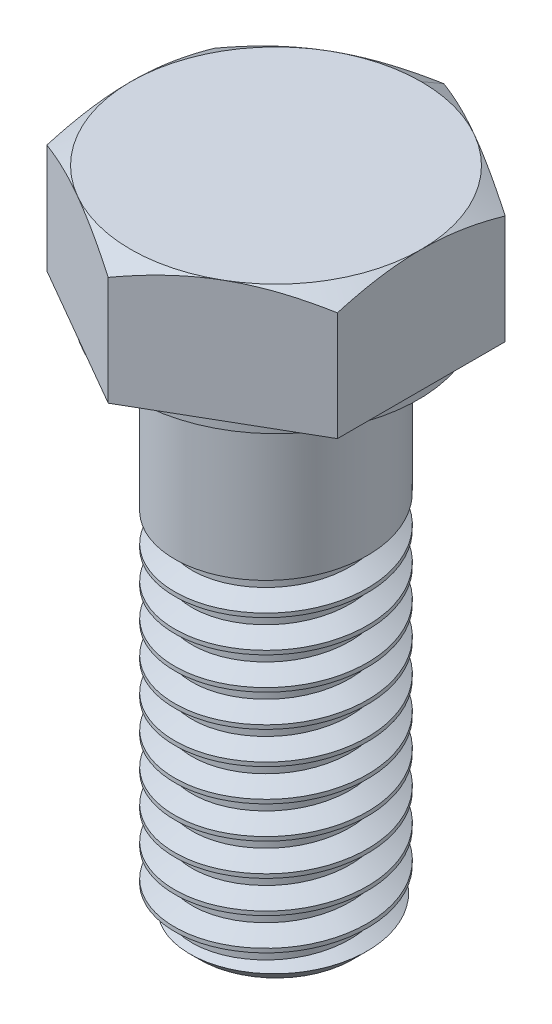
from build123d import *

# Parameters (mm, degrees)
BOSS_EXTRUDE1_DEPTH = 6
SKETCH2_R           = 7
BOSS_EXTRUDE2_DEPTH = 0.48
SKETCH3_R           = 4.745
BOSS_EXTRUDE3_DEPTH = 25.5
CHAMFER1_SIZE       = 1
CUT_SWEEP2_PITCH    = 1.5875
CUT_EXTRUDE1_DEPTH  = 10


with BuildPart() as part:
    # Sketch1 → Boss-Extrude1 (new body)
    with BuildSketch(Plane(origin=(0, 0, 0), x_dir=(1, 0, 0), z_dir=(0, 1, 0))):
        Polygon((0, 8.256108849), (-7.15, 4.128054425), (-7.15, -4.128054425), (0, -8.256108849), (7.15, -4.128054425), (7.15, 4.128054425), align=None)
    extrude(amount=-BOSS_EXTRUDE1_DEPTH)

    # Sketch2 → Boss-Extrude2 (add)
    with BuildSketch(Plane.XZ.offset(6)):
        with Locations(Location((0, 0, 0), (0, 0, 90))):
            Circle(SKETCH2_R)
    extrude(amount=BOSS_EXTRUDE2_DEPTH)

    # Sketch3 → Boss-Extrude3 (add)
    with BuildSketch(Plane.XZ.offset(6.48)):
        with Locations(Location((0, 0, 0), (0, 0, 270))):
            Circle(SKETCH3_R)
    extrude(amount=BOSS_EXTRUDE3_DEPTH)

    # Chamfer1
    chamfer1_edges = [part.edges().sort_by_distance(p)[0] for p in [
        (0, -31.98, 4.745),
    ]]
    chamfer(chamfer1_edges, length=CHAMFER1_SIZE)

    # Cut-Sweep1: sweep along a path in Sketch4
    with BuildLine(Plane(origin=(0, 0, 0), x_dir=(1, 0, 0), z_dir=(0, 1, 0))) as cut_sweep1_path:
        CenterArc((0, 0), 7.15, 0, 360)
    # Sketch5 → Cut-Sweep1 (sweep, cut)
    with BuildSketch(Plane(origin=(0, 0, 0), x_dir=(0, 0, -1), z_dir=(1, 0, 0))):
        Polygon((7.15, 0), (9.15, 0), (9.15, -1.154700538), align=None)
    sweep(path=cut_sweep1_path.line, mode=Mode.SUBTRACT)

    # Cut-Sweep2: the profile of Sketch7 profile screwed along a right-hand helix of 11.5 turns, 8 arcs to a turn; built about Z, then put on its axis
    cut_sweep2_z = Axis((0, 0, 0), (0, 0, 1))
    cut_sweep2_corners = [(3.895, 0, -0.490747729), (3.895, 0, -0.900747729), (4.7453, 0, -1.391668663), (4.7453, 0, 0.000173205)]
    with BuildLine(mode=Mode.PRIVATE) as cut_sweep2_profile:
        Line(cut_sweep2_corners[0], cut_sweep2_corners[1])
        Line(cut_sweep2_corners[1], cut_sweep2_corners[2])
        Line(cut_sweep2_corners[2], cut_sweep2_corners[3])
        Line(cut_sweep2_corners[3], cut_sweep2_corners[0])
    cut_sweep2_cap = Face(cut_sweep2_profile.wire())
    cut_sweep2_turn_angles = [0, 22.5, 45, 67.5, 90, 112.5, 135, 157.5, 180, 202.5, 225, 247.5, 270, 292.5, 315, 337.5, 360]
    cut_sweep2_turn_weights = [1, 0.9238795325112867, 1, 0.9238795325112867, 1, 0.9238795325112867, 1, 0.9238795325112867, 1, 0.9238795325112867, 1, 0.9238795325112867, 1, 0.9238795325112867, 1, 0.9238795325112867, 1]
    cut_sweep2_turn_rails = [Edge.make_bspline([Vector(p[0], p[1], 0).rotate(cut_sweep2_z, cut_sweep2_turn_angles[k]) / cut_sweep2_turn_weights[k] + Vector(0, 0, p[2] + CUT_SWEEP2_PITCH * cut_sweep2_turn_angles[k] / 360) for k in range(17)], [0, 0, 0, 1, 1, 2, 2, 3, 3, 4, 4, 5, 5, 6, 6, 7, 7, 8, 8, 8], 2, cut_sweep2_turn_weights) for p in cut_sweep2_corners]
    cut_sweep2_turn_sides = [Face.make_surface_from_curves(cut_sweep2_turn_rails[p[0]], cut_sweep2_turn_rails[p[1]]) for p in [(0, 1), (1, 2), (2, 3), (3, 0)]]
    cut_sweep2_last_angles = [3960, 3982.5, 4005, 4027.5, 4050, 4072.5, 4095, 4117.5, 4140]
    cut_sweep2_last_weights = [1, 0.9238795325112867, 1, 0.9238795325112867, 1, 0.9238795325112867, 1, 0.9238795325112898, 1]
    cut_sweep2_last_rails = [Edge.make_bspline([Vector(p[0], p[1], 0).rotate(cut_sweep2_z, cut_sweep2_last_angles[k]) / cut_sweep2_last_weights[k] + Vector(0, 0, p[2] + CUT_SWEEP2_PITCH * cut_sweep2_last_angles[k] / 360) for k in range(9)], [0, 0, 0, 1, 1, 2, 2, 3, 3, 4, 4, 4], 2, cut_sweep2_last_weights) for p in cut_sweep2_corners]
    cut_sweep2_last_sides = [Face.make_surface_from_curves(cut_sweep2_last_rails[p[0]], cut_sweep2_last_rails[p[1]]) for p in [(0, 1), (1, 2), (2, 3), (3, 0)]]
    cut_sweep2 = Plane(origin=(0, -31.98, 0), x_dir=(0, 0, 1), z_dir=(0, 1, 0)) * Solid(Shell([*[p.moved(Location((0, 0, CUT_SWEEP2_PITCH * i))) for i in range(11) for p in cut_sweep2_turn_sides], *cut_sweep2_last_sides, cut_sweep2_cap, cut_sweep2_cap.rotate(cut_sweep2_z, 4140).moved(Location((0, 0, CUT_SWEEP2_PITCH * 4140 / 360)))]))
    add(cut_sweep2, mode=Mode.SUBTRACT)

    # Sketch8 → Cut-Extrude1 (cut)
    with BuildSketch(Plane(origin=(0, 0, 0), x_dir=(0, 0, -1), z_dir=(1, 0, 0))):
        Polygon((3.895, -14.624497729), (4.745, -15.115245458), (4.745, -13.72375), (3.895, -14.214497729), align=None)
    extrude(amount=-CUT_EXTRUDE1_DEPTH, mode=Mode.SUBTRACT)


solid = part.part
